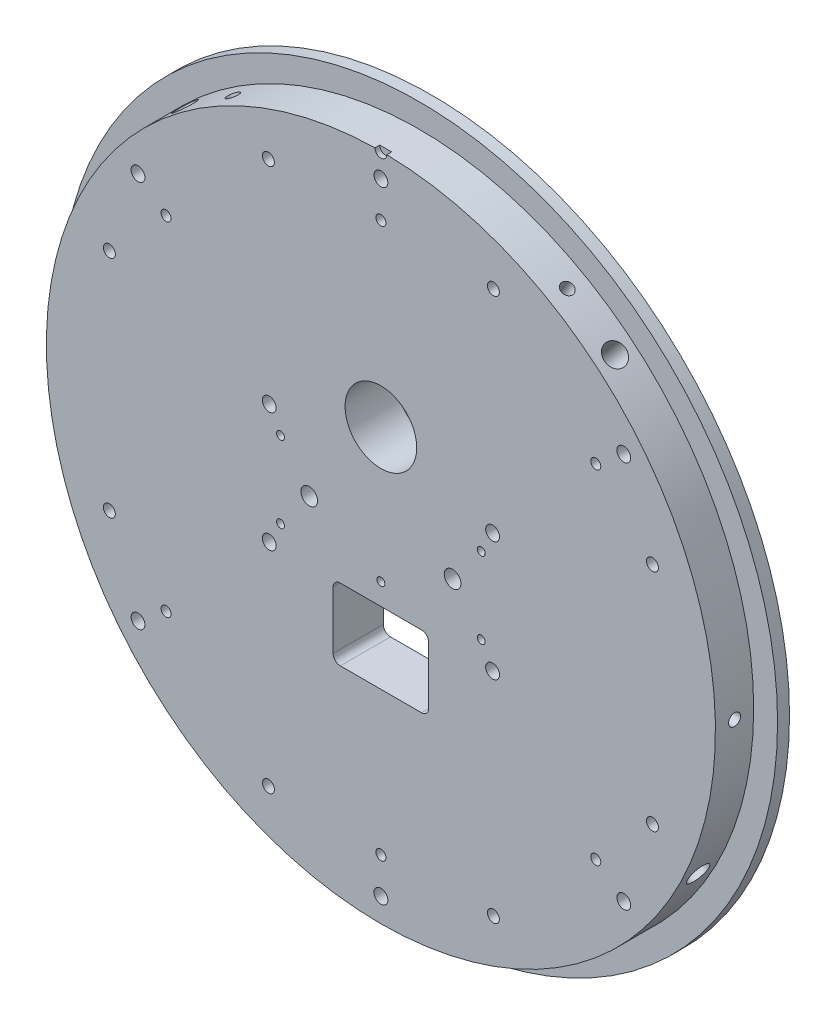
from build123d import *

# Parameters (mm, degrees)
SKETCH_1_R                   = 150
EXTRUDE_1_DEPTH              = 5
SKETCH_2_R                   = 140
EXTRUDE_2_DEPTH              = 16
SKETCH_3_R                   = 15
SKETCH_3_W                   = 40
SKETCH_3_H                   = 30
CUT_EXTRUDE_1_DEPTH          = 214.168947082
FILLET_2_R                   = 3
HOLE_WIZARD_M5_1_D           = 5.8
HOLE_WIZARD_M5_1_CBORE_D     = 10
HOLE_WIZARD_M5_1_CBORE_DEPTH = 8
HOLE_WIZARD_M6_1_D           = 7
HOLE_WIZARD_M6_1_CBORE_D     = 11
HOLE_WIZARD_M6_1_CBORE_DEPTH = 9
HOLE_WIZARD_M5_2_D           = 5.8
HOLE_WIZARD_M5_2_CBORE_D     = 10
HOLE_WIZARD_M5_2_CBORE_DEPTH = 8
M4X0_7_1_D                   = 3.3
M6X1_0_1_D                   = 5
PATTERN_CIRCULAR_1_COUNT     = 8
SKETCH_14_R                  = 2.5
CUT_EXTRUDE_2_DEPTH          = 2
M5X0_8_1_D                   = 4.2
PATTERN_CIRCULAR_2_COUNT     = 6
M10X1_0_1_D                  = 9
M10X1_0_1_DEPTH              = 25
M10X1_0_1_TIP                = 2.703872786
M10X1_0_1_ON_FACE_2_D        = 9
M10X1_0_1_ON_FACE_2_DEPTH    = 25
M10X1_0_1_ON_FACE_2_TIP      = 2.703872786
M10X1_0_1_ON_FACE_3_D        = 9
M10X1_0_1_ON_FACE_3_DEPTH    = 25
M10X1_0_1_ON_FACE_3_TIP      = 2.703872786
M10X1_0_1_ON_FACE_4_D        = 9
M10X1_0_1_ON_FACE_4_DEPTH    = 25
M10X1_0_1_ON_FACE_4_TIP      = 2.703872786


with BuildPart() as part:
    # ｽｹｯﾁ1 → ﾎﾞｽ - 押し出し1 (new body)
    with BuildSketch(Plane.XY):
        Circle(SKETCH_1_R)
    extrude(amount=EXTRUDE_1_DEPTH)

    # ｽｹｯﾁ2 → ﾎﾞｽ - 押し出し2 (add)
    with BuildSketch(Plane.XY.offset(5)):
        Circle(SKETCH_2_R)
    extrude(amount=EXTRUDE_2_DEPTH)

    # ｽｹｯﾁ3 → ｶｯﾄ - 押し出し1 (cut, through all)
    with BuildSketch(Plane(origin=(0, 0, 0), x_dir=(-1, 0, 0), z_dir=(0, 0, -1))):
        with Locations((0, 40)):
            Circle(SKETCH_3_R)
        with Locations((0, -40)):
            Rectangle(SKETCH_3_W, SKETCH_3_H)
    extrude(amount=-CUT_EXTRUDE_1_DEPTH, mode=Mode.SUBTRACT)

    # ﾌｨﾚｯﾄ2
    fillet_2_edges = [part.edges().sort_by_distance(p)[0] for p in [
        (20, -55, 10.5),
        (20, -25, 10.5),
        (-20, -25, 10.5),
        (-20, -55, 10.5),
    ]]
    fillet(fillet_2_edges, radius=FILLET_2_R)

    # M5 穴付きねじ用座ぐり穴1 (through all)
    with Locations(Plane(origin=(0, 130, 0), x_dir=(-1, 0, 0), z_dir=(0, 0, -1))):
        with Locations((0, 0), (101.640113623, -48.948859954), (-101.640113623, -48.948859954), (-101.640113623, -211.051140046), (0, -260), (101.640113623, -211.051140046)):
            CounterBoreHole(HOLE_WIZARD_M5_1_D / 2, HOLE_WIZARD_M5_1_CBORE_D / 2, HOLE_WIZARD_M5_1_CBORE_DEPTH)

    # M6 穴付きねじ用座ぐり穴1 (through all)
    with Locations(Plane(origin=(30, 0, 0), x_dir=(-1, 0, 0), z_dir=(0, 0, -1))):
        with Locations((0, 0), (60, 0)):
            CounterBoreHole(HOLE_WIZARD_M6_1_D / 2, HOLE_WIZARD_M6_1_CBORE_D / 2, HOLE_WIZARD_M6_1_CBORE_DEPTH)

    # M5 穴付きねじ用座ぐり穴2 (through all)
    with Locations(Plane(origin=(46.733285782, 25, 0), x_dir=(-1, 0, 0), z_dir=(0, 0, -1))):
        with Locations((0, 0), (0, -50), (93.466571564, 0), (93.466571564, -50)):
            CounterBoreHole(HOLE_WIZARD_M5_2_D / 2, HOLE_WIZARD_M5_2_CBORE_D / 2, HOLE_WIZARD_M5_2_CBORE_DEPTH)

    # M4x0.7 ねじ穴1 (through all)
    with Locations(Plane(origin=(42, 16, 0), x_dir=(-1, 0, 0), z_dir=(0, 0, -1))):
        with Locations((0, 0), (84, 0), (84, -32), (42, -32), (0, -32)):
            Hole(M4X0_7_1_D / 2)

    # M6x1.0 ねじ穴1 (through all)
    with Locations(Plane(origin=(-113.637182499, 47.070062181, 0), x_dir=(-1, 0, 0), z_dir=(0, 0, -1))):
        with Locations((0, 0)):
            m6x1_0_1 = Hole(M6X1_0_1_D / 2)

    # 円形ﾊﾟﾀｰﾝ1: M6x1.0 ねじ穴1 ×8 about axis
    pattern_circular_1_axis = Axis((0, 0, -1.05), (0, 0, 1))
    for i in range(1, PATTERN_CIRCULAR_1_COUNT):
        add(m6x1_0_1.rotate(pattern_circular_1_axis, i * 360 / PATTERN_CIRCULAR_1_COUNT), mode=Mode.SUBTRACT)

    # ｽｹｯﾁ14 → ｶｯﾄ - 押し出し2 (cut)
    with BuildSketch(Plane(origin=(0, 0, 21), x_dir=(-1, 0, 0), z_dir=(0, 0, -1))):
        with Locations((0, 140)):
            Circle(SKETCH_14_R)
    extrude(amount=CUT_EXTRUDE_2_DEPTH, mode=Mode.SUBTRACT)

    # M5x0.8 ねじ穴1 (through all)
    with Locations(Plane(origin=(-89.912408205, 71.699085425, 0), x_dir=(-1, 0, 0), z_dir=(0, 0, -1))):
        with Locations((0, 0), (0, -143.39817085), (-89.912408205, -186.699085425), (-179.82481641, -143.39817085), (-179.82481641, 0), (-89.912408205, 43.300914575)):
            Hole(M5X0_8_1_D / 2)

    # ｽｹｯﾁ19 → M6x1.0 ねじ穴2 (revolve, cut)
    with BuildSketch(Plane(origin=(140, 0, 13), x_dir=(0, 0, -1), z_dir=(0, 1, 0))):
        Polygon((0, 0), (0, 21.502151548), (2.5, 20), (2.5, 0), align=None)
    m6x1_0_2 = revolve(axis=Axis((146.35, 0, 13), (-1, 0, 0)), mode=Mode.SUBTRACT)

    # 円形ﾊﾟﾀｰﾝ2: M6x1.0 ねじ穴2 ×6 about axis
    pattern_circular_2_axis = Axis((0, 0, -1.05), (0, 0, 1))
    for i in range(1, PATTERN_CIRCULAR_2_COUNT):
        add(m6x1_0_2.rotate(pattern_circular_2_axis, i * 360 / PATTERN_CIRCULAR_2_COUNT), mode=Mode.SUBTRACT)

    # M10x1.0 ねじ穴1
    with Locations(Plane(origin=(-89.990265356, 107.246222037, 13), x_dir=(0.766044443119, 0.642787609687, 0), z_dir=(-0.642787609687, 0.766044443119, 0))):
        with Locations((0, 0)):
            Hole(M10X1_0_1_D / 2, depth=M10X1_0_1_DEPTH)
            with Locations((0, 0, -(M10X1_0_1_DEPTH + M10X1_0_1_TIP / 2))):  # 118° drill point
                Cone(0, M10X1_0_1_D / 2, M10X1_0_1_TIP, mode=Mode.SUBTRACT)

    # M10x1.0 ねじ穴1 on face 2
    with Locations(Plane(origin=(89.990265356, 107.246222037, 13), x_dir=(0.766044067841, -0.642788056925, 0), z_dir=(0.642788056925, 0.766044067841, 0))):
        with Locations((0, 0)):
            Hole(M10X1_0_1_ON_FACE_2_D / 2, depth=M10X1_0_1_ON_FACE_2_DEPTH)
            with Locations((0, 0, -(M10X1_0_1_ON_FACE_2_DEPTH + M10X1_0_1_ON_FACE_2_TIP / 2))):  # 118° drill point
                Cone(0, M10X1_0_1_ON_FACE_2_D / 2, M10X1_0_1_ON_FACE_2_TIP, mode=Mode.SUBTRACT)

    # M10x1.0 ねじ穴1 on face 3
    with Locations(Plane(origin=(124.740913386, -63.558669964, 13), x_dir=(0.45398991053, 0.891006824405, 0), z_dir=(0.891006824405, -0.45398991053, 0))):
        with Locations((1e-09, 0)):
            Hole(M10X1_0_1_ON_FACE_3_D / 2, depth=M10X1_0_1_ON_FACE_3_DEPTH)
            with Locations((0, 0, -(M10X1_0_1_ON_FACE_3_DEPTH + M10X1_0_1_ON_FACE_3_TIP / 2))):  # 118° drill point
                Cone(0, M10X1_0_1_ON_FACE_3_D / 2, M10X1_0_1_ON_FACE_3_TIP, mode=Mode.SUBTRACT)

    # M10x1.0 ねじ穴1 on face 4
    with Locations(Plane(origin=(-89.990265356, -107.246222037, 13), x_dir=(-0.766044067841, 0.642788056925, 0), z_dir=(-0.642788056925, -0.766044067841, 0))):
        with Locations((0, 0)):
            Hole(M10X1_0_1_ON_FACE_4_D / 2, depth=M10X1_0_1_ON_FACE_4_DEPTH)
            with Locations((0, 0, -(M10X1_0_1_ON_FACE_4_DEPTH + M10X1_0_1_ON_FACE_4_TIP / 2))):  # 118° drill point
                Cone(0, M10X1_0_1_ON_FACE_4_D / 2, M10X1_0_1_ON_FACE_4_TIP, mode=Mode.SUBTRACT)


solid = part.part
